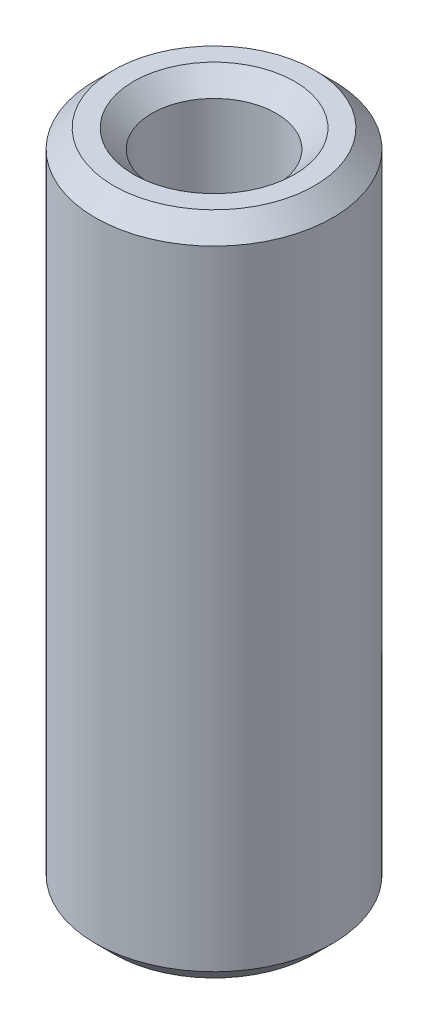
from build123d import *

# Parameters (mm, degrees)
SKETCH1_R           = 10
BOSS_EXTRUDE1_DEPTH = 56.016434131
SKETCH2_R           = 5.23333723
CUT_EXTRUDE1_DEPTH  = 58.774050341
CHAMFER1_SIZE       = 1.551102972


with BuildPart() as part:
    # Sketch1 → Boss-Extrude1 (new body)
    with BuildSketch(Plane(origin=(0, 0, 0), x_dir=(1, 0, 0), z_dir=(0, 1, 0))):
        Circle(SKETCH1_R)
    extrude(amount=BOSS_EXTRUDE1_DEPTH)

    # Sketch2 → Cut-Extrude1 (cut, through all)
    with BuildSketch(Plane(origin=(0, 0, 0), x_dir=(1, 0, 0), z_dir=(0, 1, 0))):
        Circle(SKETCH2_R)
    extrude(amount=CUT_EXTRUDE1_DEPTH, mode=Mode.SUBTRACT)

    # Chamfer1
    chamfer1_edges = [part.edges().sort_by_distance(p)[0] for p in [
        (-5.23333723, 56.016434131, 0),
        (-5.23333723, 0, 0),
        (-10, 0, 0),
        (-10, 56.016434131, 0),
    ]]
    chamfer(chamfer1_edges, length=CHAMFER1_SIZE)


solid = part.part
